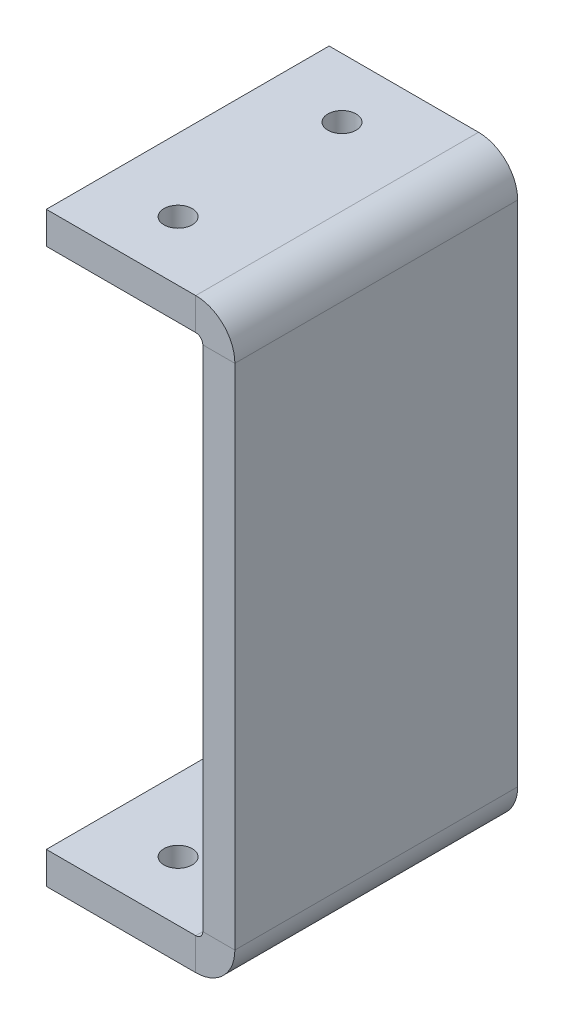
from build123d import *

# Parameters (mm, degrees)
SKETCH11_W                     = 3.4
SKETCH11_H                     = 62.2
BASE_FLANGE3_DEPTH             = 30
EDGE_FLANGE1_STRIP_W           = 15.1
EDGE_FLANGE1_STRIP_H           = 3.4
EDGE_FLANGE1_STRIP_CUT_DEPTH   = 30
EDGE_FLANGE1_STRIP_2_W         = 15.1
EDGE_FLANGE1_STRIP_2_H         = 3.4
EDGE_FLANGE1_STRIP_CUT_2_DEPTH = 30
EDGE_FLANGE1_DEPTH             = 30
EDGE_FLANGE1_BEND_DEPTH        = 30
SKETCH22_R                     = 1.5
CUT_EXTRUDE1_DEPTH             = 72.894645141


# Sheet-metal steps are written as plain solids
with BuildPart() as part:
    # Sketch11 → Base-Flange3 (new body)
    with BuildSketch(Plane.XY):
        with Locations((-1.7, 0)):
            Rectangle(SKETCH11_W, SKETCH11_H)
    extrude(amount=BASE_FLANGE3_DEPTH)

    # Edge-Flange1 strip (across the edge) → Edge-Flange1 strip cut (cut)
    with BuildSketch(Plane(origin=(-3.4, 31.1, 30), x_dir=(0, -1, 0), z_dir=(0, 0, -1))):
        with Locations((-3.4, -1.7)):
            Rectangle(EDGE_FLANGE1_STRIP_W, EDGE_FLANGE1_STRIP_H)
    extrude(amount=EDGE_FLANGE1_STRIP_CUT_DEPTH, mode=Mode.SUBTRACT)

    # Edge-Flange1 strip 2 (across the edge) → Edge-Flange1 strip cut 2 (cut)
    with BuildSketch(Plane(origin=(-3.4, -31.1, 0), x_dir=(0, 1, 0), z_dir=(0, 0, 1))):
        with Locations((-3.4, -1.7)):
            Rectangle(EDGE_FLANGE1_STRIP_2_W, EDGE_FLANGE1_STRIP_2_H)
    extrude(amount=EDGE_FLANGE1_STRIP_CUT_2_DEPTH, mode=Mode.SUBTRACT)

    # Edge-Flange1 section (across the edge) → Edge-Flange1 (add)
    with BuildSketch(Plane(origin=(-3.4, 31.1, 30), x_dir=(0, -1, 0), z_dir=(0, 0, -1))):
        with BuildLine():
            Line((0, 0.75), (0, 16.6))
            Line((0, 16.6), (3.4, 16.6))
            Line((3.4, 16.6), (3.4, 0.75))
            ThreePointArc((3.4, 0.75), (3.619669914, 0.219669914), (4.15, 0))
            Line((4.15, 0), (4.15, -3.4))
            ThreePointArc((4.15, -3.4), (1.215506858, -2.184493142), (0, 0.75))
        make_face()
    extrude(amount=EDGE_FLANGE1_DEPTH)

    # Edge-Flange1 section 2 (across the edge) → Edge-Flange1 bend (add)
    with BuildSketch(Plane(origin=(-3.4, -31.1, 0), x_dir=(0, 1, 0), z_dir=(0, 0, 1))):
        with BuildLine():
            Line((0, 0.75), (0, 16.6))
            Line((0, 16.6), (3.4, 16.6))
            Line((3.4, 16.6), (3.4, 0.75))
            ThreePointArc((3.4, 0.75), (3.619669914, 0.219669914), (4.15, 0))
            Line((4.15, 0), (4.15, -3.4))
            ThreePointArc((4.15, -3.4), (1.215506858, -2.184493142), (0, 0.75))
        make_face()
    extrude(amount=EDGE_FLANGE1_BEND_DEPTH)

    # Sketch22 → Cut-Extrude1 (cut, through all)
    with BuildSketch(Plane(origin=(0, 31.1, 0), x_dir=(1, 0, 0), z_dir=(0, 1, 0))):
        with Locations(Location((-12.329371406, -23.693332437, 0), (0, 0, 180))):
            Circle(SKETCH22_R)
        with Locations(Location((-12.329371406, -6.306667563, 0), (0, 0, 180))):
            Circle(SKETCH22_R)
    extrude(amount=-CUT_EXTRUDE1_DEPTH, mode=Mode.SUBTRACT)


solid = part.part
